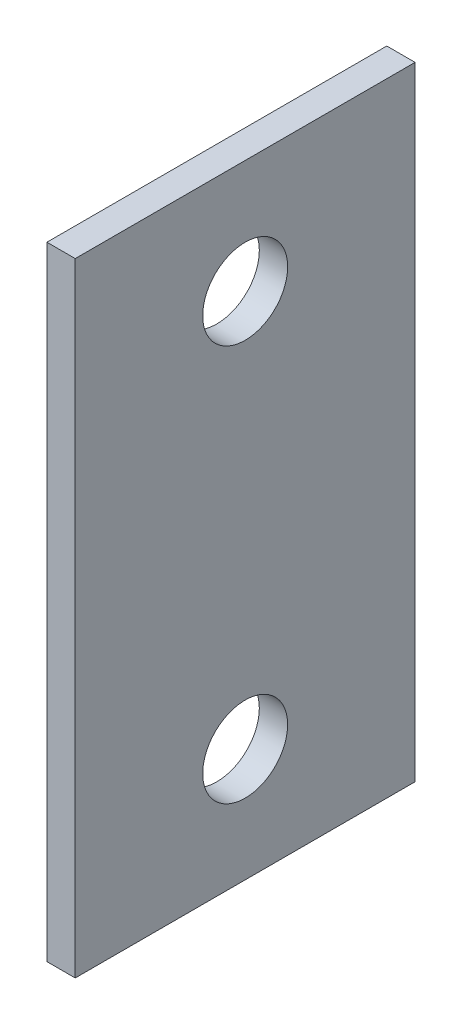
from build123d import *

# Parameters (mm, degrees)
SKETCH1_W           = 38.1
SKETCH1_H           = 69.85
SKETCH1_R           = 4.7625
BOSS_EXTRUDE1_DEPTH = 3.175


with BuildPart() as part:
    # Sketch1 → Boss-Extrude1 (new body)
    with BuildSketch(Plane(origin=(0, 0, 0), x_dir=(0, 0, -1), z_dir=(1, 0, 0))):
        Rectangle(SKETCH1_W, SKETCH1_H)
        with Locations((0, 22.225)):
            Circle(SKETCH1_R, mode=Mode.SUBTRACT)
        with Locations((0, -22.225)):
            Circle(SKETCH1_R, mode=Mode.SUBTRACT)
    extrude(amount=BOSS_EXTRUDE1_DEPTH)


solid = part.part
